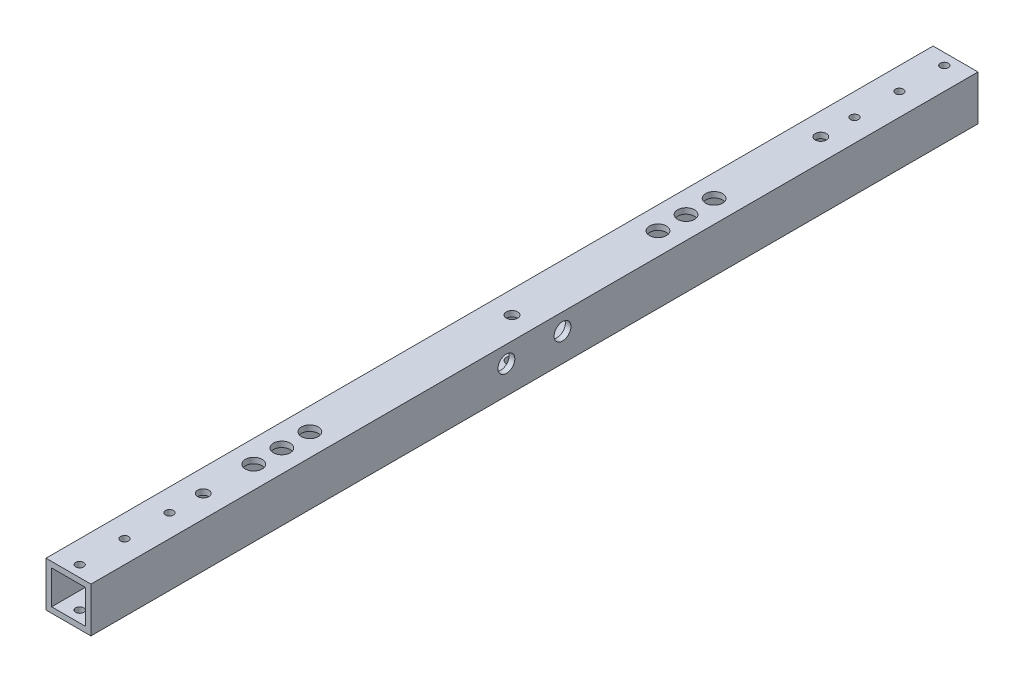
from build123d import *

# Parameters (mm, degrees)
SKETCH1_W                       = 25.4
SKETCH1_H                       = 25.4
SKETCH1_W_2                     = 19.05
SKETCH1_H_2                     = 19.05
EXTRUDE_THIN1_DEPTH             = 501.65
F_8_CLEARANCE_HOLE1_D           = 4.4958
F_1_4_0_25_DIAMETER_HOLE1_D     = 6.35
F_1_4_0_25_DIAMETER_HOLE1_DEPTH = 28.575
F_1_4_0_25_DIAMETER_HOLE1_TIP   = 1.907732465
F_3_8_0_375_DIAMETER_HOLE2_D    = 9.525
F_3_8_0_375_DIAMETER_HOLE4_D    = 9.525


with BuildPart() as part:
    # Sketch1 → Extrude-Thin1 (new body)
    with BuildSketch(Plane.XY):
        Rectangle(SKETCH1_W, SKETCH1_H)
        Rectangle(SKETCH1_W_2, SKETCH1_H_2, mode=Mode.SUBTRACT)
    extrude(amount=EXTRUDE_THIN1_DEPTH)

    # #8 Clearance Hole1 (through all)
    with Locations(Plane(origin=(0, 12.7, 495.3), x_dir=(0, 0, 1), z_dir=(0, 1, 0))):
        with Locations((0, 0), (-488.95, 0), (-463.55, 0), (-438.15, 0), (-25.4, 0), (-50.8, 0)):
            Hole(F_8_CLEARANCE_HOLE1_D / 2)

    # 1/4 (0.25) Diameter Hole1
    with Locations(Plane(origin=(381, 12.7, 250.825), x_dir=(1, 0, 0), z_dir=(0, 1, 0))):
        with Locations((-381, 174.625), (-381, 0), (-381, -174.625)):
            Hole(F_1_4_0_25_DIAMETER_HOLE1_D / 2, depth=F_1_4_0_25_DIAMETER_HOLE1_DEPTH)
            with Locations((0, 0, -(F_1_4_0_25_DIAMETER_HOLE1_DEPTH + F_1_4_0_25_DIAMETER_HOLE1_TIP / 2))):  # 118° drill point
                Cone(0, F_1_4_0_25_DIAMETER_HOLE1_D / 2, F_1_4_0_25_DIAMETER_HOLE1_TIP, mode=Mode.SUBTRACT)

    # 3/8 (0.375) Diameter Hole2 (through all)
    with Locations(Plane(origin=(381, 12.7, 250.825), x_dir=(1, 0, 0), z_dir=(0, 1, 0))):
        with Locations((-92.583, 346.075), (-35.433, 346.075), (35.814, 346.075), (92.964, 346.075), (-19.05, -346.775), (53.975, -346.775), (127, -346.775), (-381, -114.3), (-381, -130.175), (-381, -146.05), (-381, 114.3), (-381, 98.425), (-381, 82.55)):
            Hole(F_3_8_0_375_DIAMETER_HOLE2_D / 2)

    # 3/8 (0.375) Diameter Hole4 (through all)
    with Locations(Plane(origin=(12.7, -82.55, 250.825), x_dir=(0, 0, -1), z_dir=(1, 0, 0))):
        with Locations((-15.875, 85.725), (15.875, 85.725), (-15.875, 53.975), (15.875, 53.975)):
            Hole(F_3_8_0_375_DIAMETER_HOLE4_D / 2)


solid = part.part
